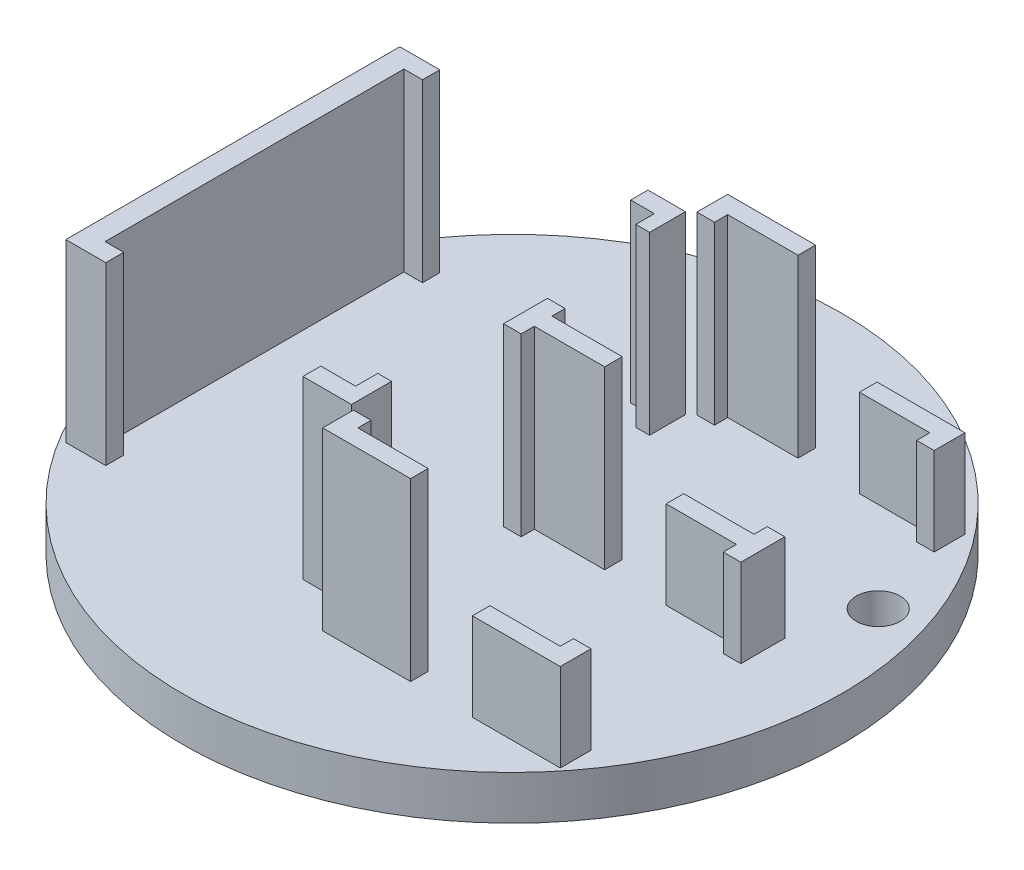
from build123d import *

# Parameters (mm, degrees)
AUFSATZ_LINEAR_AUSTRAGEN1_DEPTH = 5
SKIZZE19_W                      = 32.5
SKIZZE19_H                      = 38
SKIZZE19_W_2                    = 28.5
SKIZZE19_H_2                    = 34
AUFSATZ_LINEAR_AUSTRAGEN2_DEPTH = 20
AUFSATZ_LINEAR_START            = -5
AUFSATZ_LINEAR_AUSTRAGEN3_DEPTH = 5
AUFSATZ_LINEAR_AUSTRAGEN4_DEPTH = 20
AUFSATZ_LINEAR_AUSTRAGEN5_DEPTH = 20
SKIZZE22_W                      = 22.434160046
SKIZZE22_H                      = 2.038039055
SKIZZE22_W_2                    = 1.569230392
SKIZZE22_H_2                    = 29.361337253
SKIZZE22_W_3                    = 23.692781995
SKIZZE22_H_3                    = 1.961960945
SCHNITT_LINEAR_AUSTRAGEN1_DEPTH = 20
SCHNITT_LINEAR_AUSTRAGEN2_DEPTH = 10
SKIZZE24_R                      = 2.5
SCHNITT_LINEAR_AUSTRAGEN3_DEPTH = 5


with BuildPart() as part:
    # Skizze1 → Aufsatz-Linear austragen1 (new body)
    with BuildSketch(Plane(origin=(0, 0, 0), x_dir=(1, 0, 0), z_dir=(0, 1, 0))):
        with BuildLine():
            Line((0, 0), (0, -75))
            ThreePointArc((0, -75), (-37.5, -37.5), (0, 0))
        make_face()
    extrude(amount=AUFSATZ_LINEAR_AUSTRAGEN1_DEPTH)

    # Skizze19 → Aufsatz-Linear austragen2 (add)
    with BuildSketch(Plane(origin=(0, 5, 0), x_dir=(1, 0, 0), z_dir=(0, 1, 0))):
        with Locations((-15.13754966, -37.887563541)):
            Rectangle(SKIZZE19_W, SKIZZE19_H)
        with Locations((-14.706780052, -37.849524486)):
            Rectangle(SKIZZE19_W_2, SKIZZE19_H_2, mode=Mode.SUBTRACT)
    extrude(amount=AUFSATZ_LINEAR_AUSTRAGEN2_DEPTH)

    # Skizze20 → Aufsatz-Linear austragen3 (add)
    with BuildSketch(Plane(origin=(0, 5, 0), x_dir=(1, 0, 0), z_dir=(0, 1, 0)).offset(AUFSATZ_LINEAR_START)):
        with BuildLine():
            Line((0, -75), (0, 0))
            ThreePointArc((0, 0), (37.5, -37.5), (0, -75))
        make_face()
    extrude(amount=AUFSATZ_LINEAR_AUSTRAGEN3_DEPTH)

    # Skizze21 → Aufsatz-Linear austragen4 (add)
    with BuildSketch(Plane(origin=(0, 5, 0), x_dir=(1, 0, 0), z_dir=(0, 1, 0))):
        Polygon((1.77940669, -57.324335487), (3.779397932, -57.330254261), (3.779397932, -58.830254261), (11.77940669, -58.830254261), (11.77940669, -60.830254261), (1.77940669, -60.830254261), align=None)
        Polygon((26.815089216, -58.830254261), (26.815089216, -57.330254261), (28.815089216, -57.330254261), (28.815089216, -60.830254261), (18.815089216, -60.830254261), (18.815089216, -58.830254261), align=None)
    extrude(amount=AUFSATZ_LINEAR_AUSTRAGEN4_DEPTH)

    # Skizze15 → Aufsatz-Linear austragen5 (add)
    with BuildSketch(Plane(origin=(0, 5, 0), x_dir=(1, 0, 0), z_dir=(0, 1, 0))):
        Polygon((1.806281665, -35.274628865), (3.806281665, -35.274628865), (3.806281665, -36.774628865), (11.806281665, -36.774628865), (11.806281665, -38.774628865), (3.806281665, -38.774628865), (3.806281665, -40.274628865), (1.806281665, -40.274628865), (1.806281665, -38.774628865), align=None)
        Polygon((26.806281665, -36.774628865), (26.806281665, -35.274628865), (28.806281665, -35.274628865), (28.806281665, -38.774628865), (28.806281665, -40.274628865), (26.806281665, -40.274628865), (26.806281665, -38.774628865), (18.806281665, -38.774628865), (18.806281665, -36.774628865), align=None)
        Polygon((3.806281665, -16.774628865), (11.806281665, -16.774628865), (11.806281665, -14.774628865), (1.806281665, -14.774628865), (1.806281665, -18.274628865), (3.806281665, -18.274628865), align=None)
        Polygon((18.806281665, -16.774628865), (18.806281665, -14.774628865), (28.806281665, -14.774628865), (28.806281665, -18.274628865), (26.806281665, -18.274628865), (26.806281665, -16.774628865), align=None)
    extrude(amount=AUFSATZ_LINEAR_AUSTRAGEN5_DEPTH)

    # Skizze22 → Schnitt-Linear austragen1 (cut)
    with BuildSketch(Plane(origin=(0, 25, 0), x_dir=(1, 0, 0), z_dir=(0, 1, 0))):
        with Locations((-15.626615673, -55.868544013)):
            Rectangle(SKIZZE22_W, SKIZZE22_H)
        with Locations((0.327835144, -37.646507759)):
            Rectangle(SKIZZE22_W_2, SKIZZE22_H_2)
        with Locations((-14.997304699, -19.868544013)):
            Rectangle(SKIZZE22_W_3, SKIZZE22_H_3)
    extrude(amount=-SCHNITT_LINEAR_AUSTRAGEN1_DEPTH, mode=Mode.SUBTRACT)

    # Skizze23 → Schnitt-Linear austragen2 (cut)
    with BuildSketch(Plane(origin=(0, 25, 0), x_dir=(1, 0, 0), z_dir=(0, 1, 0))):
        Polygon((18.815089216, -58.830254261), (26.815089216, -58.830254261), (26.815089216, -57.330254261), (28.815089216, -57.330254261), (28.815089216, -60.830254261), (18.815089216, -60.830254261), align=None)
        Polygon((28.806281665, -40.274628865), (26.806281665, -40.274628865), (26.806281665, -38.774628865), (18.806281665, -38.774628865), (18.806281665, -36.774628865), (26.806281665, -36.774628865), (26.806281665, -35.274628865), (28.806281665, -35.274628865), align=None)
        Polygon((28.806281665, -18.274628865), (26.806281665, -18.274628865), (26.806281665, -16.774628865), (18.806281665, -16.774628865), (18.806281665, -14.774628865), (28.806281665, -14.774628865), align=None)
    extrude(amount=-SCHNITT_LINEAR_AUSTRAGEN2_DEPTH, mode=Mode.SUBTRACT)

    # Skizze24 → Schnitt-Linear austragen3 (cut)
    with BuildSketch(Plane(origin=(0, 5, 0), x_dir=(1, 0, 0), z_dir=(0, 1, 0))):
        with Locations((31.204763864, -27.040644209)):
            Circle(SKIZZE24_R)
    extrude(amount=-SCHNITT_LINEAR_AUSTRAGEN3_DEPTH, mode=Mode.SUBTRACT)


solid = part.part
